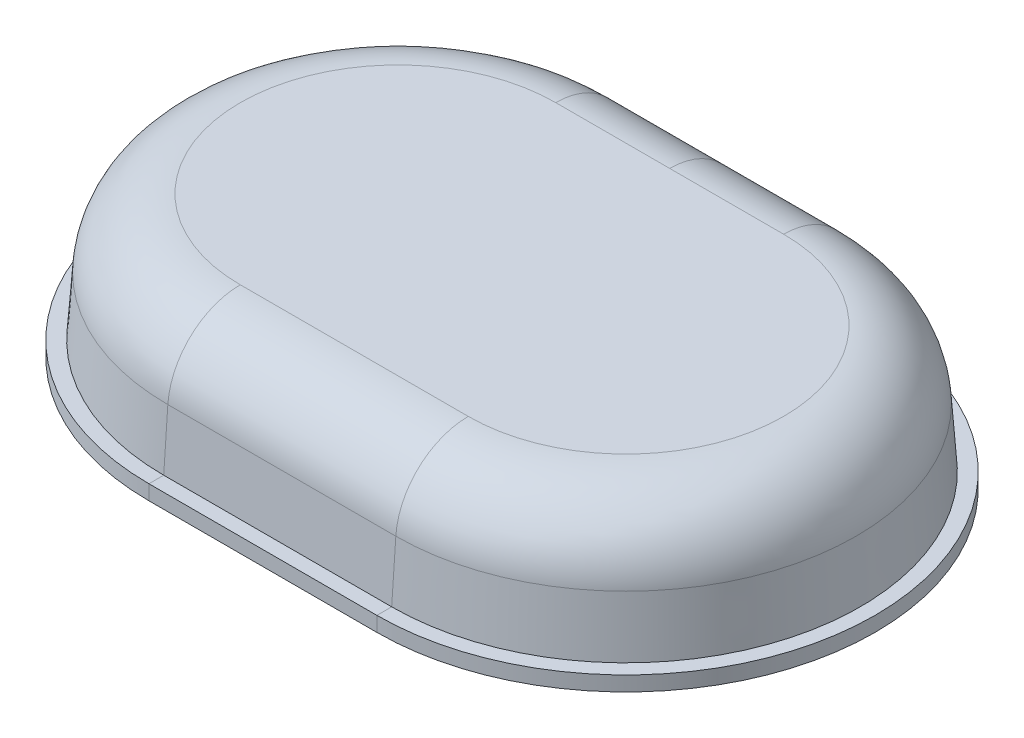
from build123d import *

# Parameters (mm, degrees)
BOSS_EXTRUDE1_DEPTH = 3.5
BOSS_EXTRUDE2_DEPTH = 30
BOSS_EXTRUDE2_TAPER = 4
SHELL1_START        = -27
SHELL1_DEPTH        = 54
SKETCH9_W           = 3.5
SKETCH9_H           = 3.5


with BuildPart() as part:
    # Sketch1 → Boss-Extrude1 (new body)
    with BuildSketch(Plane(origin=(0, 0, 0), x_dir=(1, 0, 0), z_dir=(0, 1, 0))):
        with BuildLine():
            Line((-27, 55.5), (27, 55.5))
            ThreePointArc((27, 55.5), (82.5, 0), (27, -55.5))
            Line((27, -55.5), (-27, -55.5))
            ThreePointArc((-27, -55.5), (-82.5, 0), (-27, 55.5))
        make_face()
    extrude(amount=BOSS_EXTRUDE1_DEPTH)

    # Sketch6 → Boss-Extrude2 (add)
    with BuildSketch(Plane(origin=(0, 3.5, 0), x_dir=(1, 0, 0), z_dir=(0, 1, 0))):
        with BuildLine():
            Line((-27, -55.5), (27, -55.5))
            ThreePointArc((27, -55.5), (82.5, 0), (27, 55.5))
            Line((27, 55.5), (-27, 55.5))
            ThreePointArc((-27, 55.5), (-82.5, 0), (-27, -55.5))
        make_face()
    extrude(amount=BOSS_EXTRUDE2_DEPTH, taper=BOSS_EXTRUDE2_TAPER)

    # Cut-Sweep5: sweep along a path in Sketch8
    with BuildLine(Plane(origin=(0, 33.5, 0), x_dir=(1, 0, 0), z_dir=(0, 1, 0))) as cut_sweep5_path:
        Line((-27, -53.402195642), (27, -53.402195642))
        ThreePointArc((27, -53.402195642), (80.402195642, 0), (27, 53.402195642))
        Line((27, 53.402195642), (-27, 53.402195642))
        ThreePointArc((-27, 53.402195642), (-80.402195642, 0), (-27, -53.402195642))
    # Sketch7 → Cut-Sweep5 (sweep, cut)
    with BuildSketch(Plane(origin=(0, 0, 0), x_dir=(0, 0, -1), z_dir=(1, 0, 0))):
        with BuildLine():
            Line((37.363125272, 33.5), (37.363125272, 41.316863161))
            Line((37.363125272, 41.316863161), (63.973400916, 41.316863161))
            Line((63.973400916, 41.316863161), (63.973400916, 17.5))
            Line((63.973400916, 17.5), (54.521024633, 17.5))
            ThreePointArc((54.521024633, 17.5), (49.093358758, 28.879338149), (37.363125272, 33.5))
        make_face()
    sweep(path=cut_sweep5_path.line, mode=Mode.SUBTRACT)

    # Shell1: read off the stored shape, not the designer's step
    # Shell1 outline → Shell1 (cut)
    with BuildSketch(Plane.YZ.offset(SHELL1_START)):
        with BuildLine():
            ThreePointArc((32, 37.363125272), (27.782307596, 48.070361217), (17.395365289, 53.024678557))
            Line((17.395365289, 53.024678557), (3.447618846, 54))
            Line((3.447618846, 54), (0, 54))
            Line((0, 54), (0, -54))
            Line((0, -54), (3.447618846, -54))
            Line((3.447618846, -54), (17.395365289, -53.024678557))
            ThreePointArc((17.395365289, -53.024678557), (27.782307596, -48.070361217), (32, -37.363125272))
            Line((32, -37.363125272), (32, 37.363125272))
        make_face()
    extrude(amount=SHELL1_DEPTH, mode=Mode.SUBTRACT)

    # Shell1 2 outline → Shell1 2 (revolve, cut)
    with BuildSketch(Plane(origin=(-27, 0, 0), x_dir=(1, 0, 0), z_dir=(0, 0, 1))):
        with BuildLine():
            Line((54, 3.447618846), (53.024678557, 17.395365289))
            ThreePointArc((53.024678557, 17.395365289), (48.070361217, 27.782307596), (37.363125272, 32))
            Line((37.363125272, 32), (0, 32))
            Line((0, 32), (0, 0))
            Line((0, 0), (54, 0))
            Line((54, 0), (54, 3.447618846))
        make_face()
    revolve(axis=Axis((-27, 0, 0), (0, 1, 0)), mode=Mode.SUBTRACT)

    # Shell1 3 outline → Shell1 3 (revolve, cut)
    with BuildSketch(Plane(origin=(27, 0, 0), x_dir=(1, 0, 0), z_dir=(0, 0, 1))):
        with BuildLine():
            Line((54, 3.447618846), (53.024678557, 17.395365289))
            ThreePointArc((53.024678557, 17.395365289), (48.070361217, 27.782307596), (37.363125272, 32))
            Line((37.363125272, 32), (0, 32))
            Line((0, 32), (0, 0))
            Line((0, 0), (54, 0))
            Line((54, 0), (54, 3.447618846))
        make_face()
    revolve(axis=Axis((27, 0, 0), (0, 1, 0)), mode=Mode.SUBTRACT)

    # Sweep1: sweep along a path in Sketch10
    with BuildLine(Plane.XZ) as sweep1_path:
        Line((27, -55.5), (-27, -55.5))
        ThreePointArc((-27, -55.5), (-82.5, 0), (-27, 55.5))
        Line((-27, 55.5), (27, 55.5))
        ThreePointArc((27, 55.5), (82.5, 0), (27, -55.5))
    # Sketch9 → Sweep1 (sweep)
    with BuildSketch(Plane(origin=(0, 0, 0), x_dir=(0, 0, -1), z_dir=(1, 0, 0))):
        with Locations((57.25, 1.75)):
            Rectangle(SKETCH9_W, SKETCH9_H)
    sweep(path=sweep1_path.line)


solid = part.part
